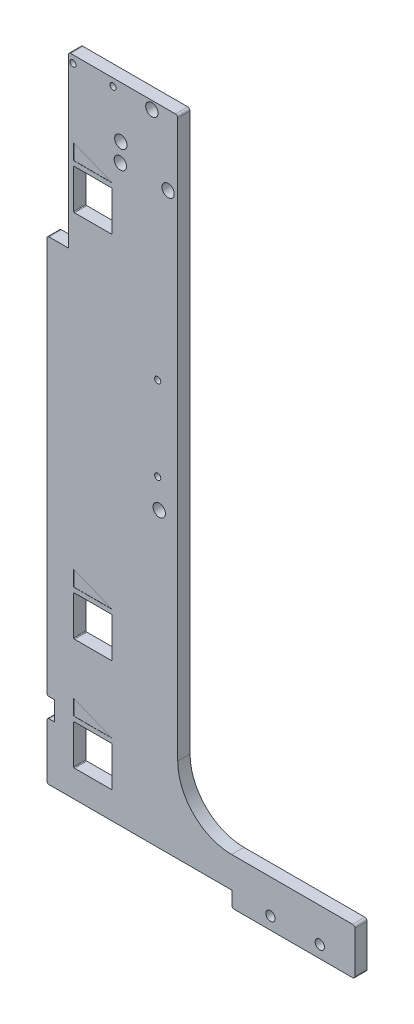
from build123d import *

# Parameters (mm, degrees)
BASE_DEPTH               = 4
REDONDEO1_R              = 35
FORATS_GUIA_LEFT_REACH   = 474.491
CROQUIS2_R               = 2
CROQUIS2_R_2             = 3
FORATS_RIGHT_REACH       = 474.491
CROQUIS4_R               = 4
TATXUELES_REACH          = 474.491
CROQUIS5_W               = 25
CROQUIS5_H               = 26
REDONDEO3_R              = 0.5
GEOMETRIA_EXTERIOR_REACH = 474.491
CROQUIS7_W               = 5
CROQUIS7_H               = 12.5
CROQUIS7_W_2             = 12.5
CROQUIS7_H_2             = 17.5
CROQUIS7_W_3             = 120.2
CROQUIS7_H_3             = 10
TRIANGLES_DEPTH          = 0.1
CROQUIS10_W              = 0.664850428
CROQUIS10_H              = 5.413782051
CUT_EXTRUDE_R_DEPTH      = 0.1
REDONDEO7_R              = 1.5
RIGHT_CUT_REACH          = 474.491
CROQUIS11_W              = 14.203186264
CROQUIS11_H              = 18.832440688
REDONDEO8_R              = 1.5


with BuildPart() as part:
    # Croquis1 → Base (new, symmetric)
    with BuildSketch(Plane.XY):
        Polygon((0, 0), (-200, 0), (-200, 428), (-115, 428), (-115, 30), (0, 30), align=None)
    extrude(amount=BASE_DEPTH, both=True)

    # Redondeo1
    redondeo1_edges = [part.edges().sort_by_distance(p)[0] for p in [
        (-115, 30, 0),
    ]]
    fillet(redondeo1_edges, radius=REDONDEO1_R)

    # Croquis2 → Forats guia Left (cut, up to next)
    with BuildSketch(Plane.XY.offset(4), mode=Mode.PRIVATE) as forats_guia_left_sk1:
        with Locations((-183, 423.2)):
            Circle(CROQUIS2_R)
    forats_guia_left_tool1 = extrude(forats_guia_left_sk1.sketch, amount=-FORATS_GUIA_LEFT_REACH, mode=Mode.PRIVATE) & part.part
    # Croquis2 → Forats guia Left (cut, up to next)
    with BuildSketch(Plane.XY.offset(4), mode=Mode.PRIVATE) as forats_guia_left_sk2:
        with Locations((-157, 423.2)):
            Circle(CROQUIS2_R)
    forats_guia_left_tool2 = extrude(forats_guia_left_sk2.sketch, amount=-FORATS_GUIA_LEFT_REACH, mode=Mode.PRIVATE) & part.part
    # Croquis2 → Forats guia Left (cut, up to next)
    with BuildSketch(Plane.XY.offset(4), mode=Mode.PRIVATE) as forats_guia_left_sk3:
        with Locations((-128, 272.65)):
            Circle(CROQUIS2_R)
    forats_guia_left_tool3 = extrude(forats_guia_left_sk3.sketch, amount=-FORATS_GUIA_LEFT_REACH, mode=Mode.PRIVATE) & part.part
    # Croquis2 → Forats guia Left (cut, up to next)
    with BuildSketch(Plane.XY.offset(4), mode=Mode.PRIVATE) as forats_guia_left_sk4:
        with Locations((-128, 218.35)):
            Circle(CROQUIS2_R)
    forats_guia_left_tool4 = extrude(forats_guia_left_sk4.sketch, amount=-FORATS_GUIA_LEFT_REACH, mode=Mode.PRIVATE) & part.part
    # Croquis2 → Forats guia Left (cut, up to next)
    with BuildSketch(Plane.XY.offset(4), mode=Mode.PRIVATE) as forats_guia_left_sk5:
        with Locations((-54.8, 8)):
            Circle(CROQUIS2_R_2)
    forats_guia_left_tool5 = extrude(forats_guia_left_sk5.sketch, amount=-FORATS_GUIA_LEFT_REACH, mode=Mode.PRIVATE) & part.part
    # Croquis2 → Forats guia Left (cut, up to next)
    with BuildSketch(Plane.XY.offset(4), mode=Mode.PRIVATE) as forats_guia_left_sk6:
        with Locations((-22.8, 8)):
            Circle(CROQUIS2_R_2)
    forats_guia_left_tool6 = extrude(forats_guia_left_sk6.sketch, amount=-FORATS_GUIA_LEFT_REACH, mode=Mode.PRIVATE) & part.part
    add(forats_guia_left_tool1.solids().sort_by_distance((-183, 423.2, 4))[0], mode=Mode.SUBTRACT)
    add(forats_guia_left_tool2.solids().sort_by_distance((-157, 423.2, 4))[0], mode=Mode.SUBTRACT)
    add(forats_guia_left_tool3.solids().sort_by_distance((-128, 272.65, 4))[0], mode=Mode.SUBTRACT)
    add(forats_guia_left_tool4.solids().sort_by_distance((-128, 218.35, 4))[0], mode=Mode.SUBTRACT)
    add(forats_guia_left_tool5.solids().sort_by_distance((-54.8, 8, 4))[0], mode=Mode.SUBTRACT)
    add(forats_guia_left_tool6.solids().sort_by_distance((-22.8, 8, 4))[0], mode=Mode.SUBTRACT)

    # Croquis4 → Forats Right (cut, up to next)
    with BuildSketch(Plane(origin=(0, 0, -4), x_dir=(-1, 0, 0), z_dir=(0, 0, -1)), mode=Mode.PRIVATE) as forats_right_sk1:
        with Locations((131.8, 422.75)):
            Circle(CROQUIS4_R)
    forats_right_tool1 = extrude(forats_right_sk1.sketch, amount=-FORATS_RIGHT_REACH, mode=Mode.PRIVATE) & part.part
    # Croquis4 → Forats Right (cut, up to next)
    with BuildSketch(Plane(origin=(0, 0, -4), x_dir=(-1, 0, 0), z_dir=(0, 0, -1)), mode=Mode.PRIVATE) as forats_right_sk2:
        with Locations((151.95, 394.65)):
            Circle(CROQUIS4_R)
    forats_right_tool2 = extrude(forats_right_sk2.sketch, amount=-FORATS_RIGHT_REACH, mode=Mode.PRIVATE) & part.part
    # Croquis4 → Forats Right (cut, up to next)
    with BuildSketch(Plane(origin=(0, 0, -4), x_dir=(-1, 0, 0), z_dir=(0, 0, -1)), mode=Mode.PRIVATE) as forats_right_sk3:
        with Locations((152.25, 382.59)):
            Circle(CROQUIS4_R)
    forats_right_tool3 = extrude(forats_right_sk3.sketch, amount=-FORATS_RIGHT_REACH, mode=Mode.PRIVATE) & part.part
    # Croquis4 → Forats Right (cut, up to next)
    with BuildSketch(Plane(origin=(0, 0, -4), x_dir=(-1, 0, 0), z_dir=(0, 0, -1)), mode=Mode.PRIVATE) as forats_right_sk4:
        with Locations((121.25, 382.59)):
            Circle(CROQUIS4_R)
    forats_right_tool4 = extrude(forats_right_sk4.sketch, amount=-FORATS_RIGHT_REACH, mode=Mode.PRIVATE) & part.part
    # Croquis4 → Forats Right (cut, up to next)
    with BuildSketch(Plane(origin=(0, 0, -4), x_dir=(-1, 0, 0), z_dir=(0, 0, -1)), mode=Mode.PRIVATE) as forats_right_sk5:
        with Locations((127, 200)):
            Circle(CROQUIS4_R)
    forats_right_tool5 = extrude(forats_right_sk5.sketch, amount=-FORATS_RIGHT_REACH, mode=Mode.PRIVATE) & part.part
    add(forats_right_tool1.solids().sort_by_distance((-131.8, 422.75, -4))[0], mode=Mode.SUBTRACT)
    add(forats_right_tool2.solids().sort_by_distance((-151.95, 394.65, -4))[0], mode=Mode.SUBTRACT)
    add(forats_right_tool3.solids().sort_by_distance((-152.25, 382.59, -4))[0], mode=Mode.SUBTRACT)
    add(forats_right_tool4.solids().sort_by_distance((-121.25, 382.59, -4))[0], mode=Mode.SUBTRACT)
    add(forats_right_tool5.solids().sort_by_distance((-127, 200, -4))[0], mode=Mode.SUBTRACT)

    # Croquis5 → Tatxueles (cut, up to next)
    with BuildSketch(Plane.XY.offset(4), mode=Mode.PRIVATE) as tatxueles_sk1:
        with Locations((-170, 40.5)):
            Rectangle(CROQUIS5_W, CROQUIS5_H)
    tatxueles_tool1 = extrude(tatxueles_sk1.sketch, amount=-TATXUELES_REACH, mode=Mode.PRIVATE) & part.part
    # Croquis5 → Tatxueles (cut, up to next)
    with BuildSketch(Plane.XY.offset(4), mode=Mode.PRIVATE) as tatxueles_sk2:
        with Locations((-170, 113)):
            Rectangle(CROQUIS5_W, CROQUIS5_H)
    tatxueles_tool2 = extrude(tatxueles_sk2.sketch, amount=-TATXUELES_REACH, mode=Mode.PRIVATE) & part.part
    # Croquis5 → Tatxueles (cut, up to next)
    with BuildSketch(Plane.XY.offset(4), mode=Mode.PRIVATE) as tatxueles_sk3:
        with Locations((-170, 352.7)):
            Rectangle(CROQUIS5_W, CROQUIS5_H)
    tatxueles_tool3 = extrude(tatxueles_sk3.sketch, amount=-TATXUELES_REACH, mode=Mode.PRIVATE) & part.part
    add(tatxueles_tool1.solids().sort_by_distance((-170, 40.5, 4))[0], mode=Mode.SUBTRACT)
    add(tatxueles_tool2.solids().sort_by_distance((-170, 113, 4))[0], mode=Mode.SUBTRACT)
    add(tatxueles_tool3.solids().sort_by_distance((-170, 352.7, 4))[0], mode=Mode.SUBTRACT)

    # Redondeo3
    redondeo3_edges = [part.edges().sort_by_distance(p)[0] for p in [
        (-182.5, 339.7, 0),
        (-182.5, 365.7, 0),
        (-157.5, 365.7, 0),
        (-157.5, 339.7, 0),
        (-182.5, 27.5, 0),
        (-182.5, 53.5, 0),
        (-157.5, 53.5, 0),
        (-157.5, 27.5, 0),
        (-182.5, 100, 0),
        (-182.5, 126, 0),
        (-157.5, 126, 0),
        (-157.5, 100, 0),
    ]]
    fillet(redondeo3_edges, radius=REDONDEO3_R)

    # Croquis7 → Geometria exterior (cut, up to next)
    with BuildSketch(Plane.XY.offset(4), mode=Mode.PRIVATE) as geometria_exterior_sk1:
        with Locations((-197.5, 53.25)):
            Rectangle(CROQUIS7_W, CROQUIS7_H)
    geometria_exterior_tool1 = extrude(geometria_exterior_sk1.sketch, amount=-GEOMETRIA_EXTERIOR_REACH, mode=Mode.PRIVATE) & part.part
    # Croquis7 → Geometria exterior (cut, up to next)
    with BuildSketch(Plane.XY.offset(4), mode=Mode.PRIVATE) as geometria_exterior_sk2:
        Polygon((-200, 428), (-200, 336.7), (-187.5, 336.7), (-186, 336.7), (-186, 428), align=None)
    geometria_exterior_tool2 = extrude(geometria_exterior_sk2.sketch, amount=-GEOMETRIA_EXTERIOR_REACH, mode=Mode.PRIVATE) & part.part
    # Croquis7 → Geometria exterior (cut, up to next)
    with BuildSketch(Plane.XY.offset(4), mode=Mode.PRIVATE) as geometria_exterior_sk3:
        with Locations((-193.75, 327.95)):
            Rectangle(CROQUIS7_W_2, CROQUIS7_H_2)
    geometria_exterior_tool3 = extrude(geometria_exterior_sk3.sketch, amount=-GEOMETRIA_EXTERIOR_REACH, mode=Mode.PRIVATE) & part.part
    # Croquis7 → Geometria exterior (cut, up to next)
    with BuildSketch(Plane.XY.offset(4), mode=Mode.PRIVATE) as geometria_exterior_sk4:
        with Locations((-139.9, 5)):
            Rectangle(CROQUIS7_W_3, CROQUIS7_H_3)
    geometria_exterior_tool4 = extrude(geometria_exterior_sk4.sketch, amount=-GEOMETRIA_EXTERIOR_REACH, mode=Mode.PRIVATE) & part.part
    add(geometria_exterior_tool1.solids().sort_by_distance((-197.5, 53.25, 4))[0], mode=Mode.SUBTRACT)
    add(geometria_exterior_tool2.solids().sort_by_distance((-193, 382.35, 4))[0], mode=Mode.SUBTRACT)
    add(geometria_exterior_tool3.solids().sort_by_distance((-193.75, 327.95, 4))[0], mode=Mode.SUBTRACT)
    add(geometria_exterior_tool4.solids().sort_by_distance((-139.9, 5, 4))[0], mode=Mode.SUBTRACT)

    # Croquis8 → Triangles (cut)
    with BuildSketch(Plane.XY.offset(4)):
        Polygon((-182.5, 66.5), (-182.5, 56.5), (-157.5, 56.5), align=None)
        Polygon((-182.5, 129), (-182.5, 139), (-157.5, 129), align=None)
        Polygon((-182.5, 368.7), (-182.5, 378.7), (-157.5, 368.7), align=None)
    triangles = extrude(amount=-TRIANGLES_DEPTH, mode=Mode.SUBTRACT)

    # Simetría1: Triangles across plane
    add(triangles.mirror(Plane.XY), mode=Mode.SUBTRACT)

    # Croquis10 → R (cut)
    # profile 1 of 8: a face of its own
    with BuildSketch(Plane(origin=(0, 0, -4), x_dir=(-1, 0, 0), z_dir=(0, 0, -1))):
        with BuildLine():
            Line((151.982138716, 278.893297564), (163.048845446, 278.893297564))
            add(Edge.make_bspline(
                [(163.048845446, 278.893297564), (163.780351393, 278.890701138), (165.187243381, 278.885707478), (167.215904786, 278.806920765), (169.079509273, 278.697282587), (170.780816077, 278.529971817), (172.319097351, 278.308137959), (173.695894812, 278.04663255), (174.911168218, 277.748591072), (175.975166721, 277.377207874), (176.935372757, 276.958293258), (177.830418276, 276.476952683), (178.680049315, 275.938546028), (179.478587006, 275.328906357), (180.232970831, 274.659000937), (180.94462398, 273.928155443), (181.603490133, 273.130172605), (182.205489566, 272.270094664), (182.754163591, 271.365312393), (183.239076352, 270.414583519), (183.633408216, 269.417246874), (183.981842689, 268.38771613), (184.232808751, 267.311273941), (184.407351977, 266.198399655), (184.535145698, 265.045175836), (184.542493226, 264.261726775), (184.54624128, 263.862080951)],
                knots=[0, 0, 0, 0, 1.749336639, 3.364467119, 4.854658419, 6.213483162, 7.451590619, 8.570285859, 9.5643256, 10.440900261, 11.26203566, 12.067320669, 12.869050712, 13.665104639, 14.467235401, 15.27997916, 16.102287765, 16.939272006, 17.78853747, 18.631303466, 19.488103222, 20.351255419, 21.228522269, 22.127379805, 23.044756219, 24, 24, 24, 24], degree=3))
            add(Edge.make_bspline(
                [(184.54624128, 263.862080951), (184.536505185, 263.444942517), (184.517414477, 262.627010076), (184.414581541, 261.425534031), (184.226635237, 260.276045791), (183.941963216, 259.181910915), (183.614769704, 258.12951162), (183.179686263, 257.138265331), (182.688651598, 256.193755807), (182.105464072, 255.309343493), (181.465444253, 254.465383824), (180.721114667, 253.694212027), (179.920696438, 252.954380536), (179.019195142, 252.292229887), (178.056349793, 251.662987846), (177.013029667, 251.092726983), (175.896043831, 250.567112254), (175.110747471, 250.273993173), (174.70916863, 250.124100181)],
                knots=[0, 0, 0, 0, 1.099860209, 2.156625411, 3.176576793, 4.16617041, 5.135385252, 6.078461593, 7.016046972, 7.938469504, 8.868247731, 9.803980173, 10.76021508, 11.73834243, 12.748633912, 13.790971185, 14.870363756, 16, 16, 16, 16], degree=3))
            Line((174.70916863, 250.124100181), (186.920707092, 225.976630897))
            Line((186.920707092, 225.976630897), (176.362814463, 225.976630897))
            Line((176.362814463, 225.976630897), (164.70249128, 249.042870213))
            Line((164.70249128, 249.042870213), (161.480001963, 249.042870213))
            Line((161.480001963, 249.042870213), (161.480001963, 225.976630897))
            Line((161.480001963, 225.976630897), (151.982138716, 225.976630897))
            Line((151.982138716, 225.976630897), (151.982138716, 278.893297564))
        make_face()
        with BuildLine():
            Line((161.480001963, 258.540733461), (165.179504501, 258.540733461))
            add(Edge.make_bspline(
                [(165.179504501, 258.540733461), (165.631799438, 258.545827511), (166.497847057, 258.555581521), (167.743337281, 258.600824664), (168.874539438, 258.709838283), (169.896311291, 258.847572916), (170.813794305, 259.006607441), (171.618804854, 259.23451357), (172.323746921, 259.478720757), (172.920266918, 259.782206943), (173.429919897, 260.127336559), (173.869972624, 260.519412383), (174.233959325, 260.973190225), (174.533538946, 261.476338361), (174.76657932, 262.033307012), (174.936680941, 262.637981925), (175.031742592, 263.297251125), (175.042679759, 263.752236641), (175.048378032, 263.989284476)],
                knots=[0, 0, 0, 0, 1.688639943, 3.233382647, 4.650958383, 5.928841754, 7.082724185, 8.122798841, 9.049171256, 9.863274652, 10.613301712, 11.341792392, 12.054588806, 12.776240173, 13.521029143, 14.301969904, 15.115324896, 16, 16, 16, 16], degree=3))
            add(Edge.make_bspline(
                [(175.048378032, 263.989284476), (175.037604924, 264.269729371), (175.016443151, 264.820611397), (174.806452621, 265.613688351), (174.472193056, 266.347735333), (174.014014743, 267.019435738), (173.436998726, 267.608294681), (172.774827321, 268.127378529), (172.013209271, 268.537831196), (171.308008269, 268.808561404), (170.666440192, 268.970542081), (170.087445244, 269.091248649), (169.416965608, 269.176796858), (168.654495109, 269.267535962), (167.80197731, 269.326375678), (166.854765479, 269.369316942), (165.815580001, 269.386886323), (165.091169025, 269.392502944), (164.713091573, 269.395434316)],
                knots=[0, 0, 0, 0, 1.020303359, 2.004196876, 2.966617323, 3.9489082, 4.950758222, 5.960522915, 7.003732012, 8.091992268, 8.70421221, 9.413913587, 10.24622431, 11.166358409, 12.212345909, 13.359657661, 14.621978493, 16, 16, 16, 16], degree=3))
            Line((164.713091573, 269.395434316), (161.480001963, 269.395434316))
            Line((161.480001963, 269.395434316), (161.480001963, 258.540733461))
        make_face(mode=Mode.SUBTRACT)
    # profile 2 of 8: a face of its own
    with BuildSketch(Plane(origin=(0, 0, -4), x_dir=(-1, 0, 0), z_dir=(0, 0, -1))):
        with BuildLine():
            Line((151.033993717, 214.181050645), (151.660259075, 214.556513052))
            add(Edge.make_bspline(
                [(151.660259075, 214.556513052), (151.718506011, 214.459010104), (151.830104891, 214.272198218), (152.016268601, 214.019768699), (152.209166597, 213.8052188), (152.410227353, 213.629796648), (152.61822361, 213.491686504), (152.83451319, 213.39389178), (153.058367223, 213.332897966), (153.210711812, 213.325489449), (153.286768156, 213.32179083)],
                knots=[0, 0, 0, 0, 1.272034388, 2.437168799, 3.508375237, 4.49857839, 5.41946034, 6.295179144, 7.148887113, 8, 8, 8, 8], degree=3))
            add(Edge.make_bspline(
                [(153.286768156, 213.32179083), (153.351722011, 213.323599887), (153.480493181, 213.327186346), (153.670066595, 213.361647377), (153.854178076, 213.414589716), (154.029033026, 213.490410688), (154.192218744, 213.582143816), (154.335319582, 213.692943225), (154.459030522, 213.816993027), (154.560226481, 213.955386313), (154.637865889, 214.104224278), (154.6975391, 214.256996708), (154.730654506, 214.416103511), (154.735642968, 214.523228991), (154.738160384, 214.577289628)],
                knots=[0, 0, 0, 0, 1.095163259, 2.171163733, 3.241058638, 4.321873601, 5.38011039, 6.391990106, 7.366004449, 8.327778327, 9.272591725, 10.192022065, 11.087607919, 12, 12, 12, 12], degree=3))
            add(Edge.make_bspline(
                [(154.738160384, 214.577289628), (154.73503976, 214.638971093), (154.728695986, 214.764360498), (154.675077687, 214.94935643), (154.590730114, 215.13243237), (154.512915852, 215.245676716), (154.472517021, 215.304469783)],
                knots=[0, 0, 0, 0, 0.938893495, 1.908633276, 2.914225137, 4, 4, 4, 4], degree=3))
            add(Edge.make_bspline(
                [(154.472517021, 215.304469783), (154.439347554, 215.346902226), (154.369712408, 215.435983833), (154.249999007, 215.568582915), (154.109524065, 215.705358568), (153.953094873, 215.851533572), (153.775013169, 216.000309408), (153.580856597, 216.158780597), (153.365668095, 216.320920601), (153.214750827, 216.429659198), (153.136880002, 216.485766524)],
                knots=[0, 0, 0, 0, 0.722233717, 1.516239348, 2.393582979, 3.351407094, 4.387010283, 5.505090956, 6.712668013, 8, 8, 8, 8], degree=3))
            add(Edge.make_bspline(
                [(153.136880002, 216.485766524), (153.058935877, 216.541283701), (152.909912645, 216.647428316), (152.701508645, 216.804959718), (152.515147865, 216.948985908), (152.351658614, 217.080862734), (152.2111128, 217.20060808), (152.092402914, 217.307072052), (151.998552968, 217.403133922), (151.946365322, 217.465451429), (151.922934356, 217.493430453)],
                knots=[0, 0, 0, 0, 1.452282411, 2.77665338, 3.964542531, 5.026858415, 5.96415736, 6.766646006, 7.446254459, 8, 8, 8, 8], degree=3))
            add(Edge.make_bspline(
                [(151.922934356, 217.493430453), (151.890184135, 217.537035981), (151.82577643, 217.622792104), (151.740758386, 217.75682972), (151.668497158, 217.894038965), (151.611850221, 218.034788545), (151.564148558, 218.177102478), (151.532064271, 218.322837614), (151.511974148, 218.471340023), (151.509916776, 218.571275266), (151.50888688, 218.621301714)],
                knots=[0, 0, 0, 0, 1.068054152, 2.10047183, 3.106115577, 4.101338837, 5.06977816, 6.043150881, 7.020423561, 8, 8, 8, 8], degree=3))
            add(Edge.make_bspline(
                [(151.50888688, 218.621301714), (151.511649572, 218.699681403), (151.517115906, 218.854765472), (151.563345001, 219.081314063), (151.636312626, 219.297608646), (151.738536805, 219.501507852), (151.870314869, 219.687702512), (152.022812181, 219.858334392), (152.204446494, 220.001777891), (152.403736213, 220.127110082), (152.621872201, 220.225208957), (152.850452946, 220.299209698), (153.089841749, 220.341139294), (153.25198505, 220.347156479), (153.334257473, 220.350209633)],
                knots=[0, 0, 0, 0, 1.005424448, 1.989358655, 2.955360095, 3.929531133, 4.905563448, 5.876582895, 6.856512386, 7.866279853, 8.892233794, 9.918561126, 10.94386622, 12, 12, 12, 12], degree=3))
            add(Edge.make_bspline(
                [(153.334257473, 220.350209633), (153.421557485, 220.347198566), (153.595169346, 220.341210513), (153.850543519, 220.289145739), (154.096417035, 220.202995983), (154.294205279, 220.105229991), (154.449002958, 220.007585161), (154.567055242, 219.918643199), (154.686683846, 219.816249219), (154.808853729, 219.700130482), (154.931494791, 219.569221525), (155.056427765, 219.424418901), (155.183944801, 219.266607524), (155.265978038, 219.153948997), (155.308032179, 219.096194876)],
                knots=[0, 0, 0, 0, 1.286793592, 2.559021753, 3.825965368, 5.121522368, 5.803751409, 6.523245864, 7.299691795, 8.125521123, 9.008227632, 9.944561021, 10.946284179, 12, 12, 12, 12], degree=3))
            Line((155.308032179, 219.096194876), (154.70699552, 218.640594249))
            add(Edge.make_bspline(
                [(154.70699552, 218.640594249), (154.670703296, 218.687348643), (154.600812959, 218.777386676), (154.494705545, 218.903479294), (154.394695907, 219.018660842), (154.296164227, 219.118705363), (154.204314374, 219.209091546), (154.115166635, 219.286476364), (154.030003925, 219.351618041), (153.92265313, 219.42113691), (153.78778396, 219.490048176), (153.618483358, 219.548360391), (153.441559076, 219.583401939), (153.321058023, 219.588035084), (153.260055416, 219.590380573)],
                knots=[0, 0, 0, 0, 1.181633172, 2.275549214, 3.290209073, 4.226197932, 5.078386478, 5.862611352, 6.581680152, 7.217281963, 8.414376989, 9.595101626, 10.782541182, 12, 12, 12, 12], degree=3))
            add(Edge.make_bspline(
                [(153.260055416, 219.590380573), (153.18352411, 219.587815808), (153.035940696, 219.582869901), (152.826411363, 219.528852599), (152.637829222, 219.443800994), (152.475792959, 219.324600957), (152.340883025, 219.183374856), (152.243293137, 219.020859613), (152.184555289, 218.841403527), (152.177387663, 218.716220355), (152.173737307, 218.652466578)],
                knots=[0, 0, 0, 0, 1.14458467, 2.207223713, 3.21896685, 4.227309161, 5.202851033, 6.127160689, 7.046193047, 8, 8, 8, 8], degree=3))
            add(Edge.make_bspline(
                [(152.173737307, 218.652466578), (152.174569425, 218.612775948), (152.176235022, 218.533329787), (152.19946501, 218.41595761), (152.22930859, 218.298881942), (152.276600494, 218.182629142), (152.34188972, 218.065166082), (152.427625675, 217.94447007), (152.535603853, 217.819477287), (152.618316862, 217.738181679), (152.66198684, 217.695260047)],
                knots=[0, 0, 0, 0, 0.858281714, 1.717966888, 2.583508476, 3.4729293, 4.427298488, 5.488583878, 6.674047936, 8, 8, 8, 8], degree=3))
            add(Edge.make_bspline(
                [(152.66198684, 217.695260047), (152.678203411, 217.680788342), (152.716730273, 217.646406885), (152.787164316, 217.590119891), (152.880176572, 217.520687356), (152.993338231, 217.434777536), (153.128735814, 217.335121775), (153.286384208, 217.222994296), (153.464526119, 217.094755074), (153.590937507, 217.00509828), (153.657778439, 216.957691604)],
                knots=[0, 0, 0, 0, 0.420754252, 0.999615792, 1.744751191, 2.668019286, 3.750313428, 4.999500688, 6.413464383, 8, 8, 8, 8], degree=3))
            add(Edge.make_bspline(
                [(153.657778439, 216.957691604), (153.738181956, 216.89918406), (153.893872222, 216.785892309), (154.115397433, 216.61567912), (154.316255993, 216.44920801), (154.497153107, 216.287542075), (154.659875897, 216.131907611), (154.802619072, 215.980432213), (154.926837096, 215.834201084), (155.060566442, 215.646722465), (155.197213826, 215.41646917), (155.314565017, 215.134363565), (155.388560186, 214.851161354), (155.39823656, 214.660816216), (155.403010811, 214.56690134)],
                knots=[0, 0, 0, 0, 1.163667725, 2.253281268, 3.268753668, 4.215851969, 5.092017293, 5.902905408, 6.650798638, 7.335211899, 8.59617414, 9.77448103, 10.901945474, 12, 12, 12, 12], degree=3))
            add(Edge.make_bspline(
                [(155.403010811, 214.56690134), (155.401619869, 214.5004838), (155.398864995, 214.368938505), (155.367197728, 214.175781926), (155.320801103, 213.988179918), (155.250872291, 213.808451397), (155.165521606, 213.633308316), (155.057219715, 213.467344927), (154.931685116, 213.30688805), (154.787680313, 213.156216326), (154.630103153, 213.017900212), (154.463556, 212.894860365), (154.287766255, 212.79226908), (154.103687552, 212.708553131), (153.911277606, 212.643077186), (153.71060113, 212.595636613), (153.501327331, 212.566520358), (153.359086312, 212.563498263), (153.286768156, 212.56196177)],
                knots=[0, 0, 0, 0, 0.983748083, 1.948392443, 2.894712957, 3.844097841, 4.80183111, 5.778335162, 6.776009319, 7.81870978, 8.863265674, 9.881300176, 10.883814829, 11.87499822, 12.874611388, 13.892143829, 14.928324115, 16, 16, 16, 16], degree=3))
            add(Edge.make_bspline(
                [(153.286768156, 212.56196177), (153.230813347, 212.563043771), (153.119608422, 212.565194146), (152.955123352, 212.584204523), (152.793961221, 212.611101226), (152.638144324, 212.653803007), (152.485665136, 212.705612609), (152.337186823, 212.769405413), (152.192637426, 212.845853489), (152.051206875, 212.933261291), (151.913254872, 213.034983517), (151.780075332, 213.153460751), (151.647298556, 213.285425404), (151.518843567, 213.434461096), (151.392112078, 213.598160038), (151.269602778, 213.77805381), (151.148779809, 213.973162542), (151.072970402, 214.110460306), (151.033993717, 214.181050645)],
                knots=[0, 0, 0, 0, 0.915332311, 1.819136955, 2.706846663, 3.586547465, 4.459518054, 5.340707479, 6.227863349, 7.133153174, 8.059268498, 9.028702269, 10.047606654, 11.120612155, 12.245963614, 13.433783089, 14.680604001, 16, 16, 16, 16], degree=3))
        make_face()
    # profile 3 of 8: a face of its own
    with BuildSketch(Plane(origin=(0, 0, -4), x_dir=(-1, 0, 0), z_dir=(0, 0, -1))):
        with BuildLine():
            add(Edge.make_bspline(
                [(156.967190165, 220.445188266), (157.008446783, 220.443274476), (157.089235166, 220.439526909), (157.206060916, 220.407435116), (157.312438258, 220.353037449), (157.406794459, 220.280055458), (157.487760953, 220.194225802), (157.54444679, 220.094190086), (157.580879695, 219.986115967), (157.585279304, 219.910730695), (157.587519358, 219.872348388)],
                knots=[0, 0, 0, 0, 1.055194115, 2.066272739, 3.074728998, 4.095836921, 5.109056067, 6.073838105, 7.019297344, 8, 8, 8, 8], degree=3))
            add(Edge.make_bspline(
                [(157.587519358, 219.872348388), (157.585228787, 219.834962439), (157.580700598, 219.761054842), (157.544474931, 219.654854326), (157.487277861, 219.556208593), (157.406846378, 219.47054559), (157.312424501, 219.397603944), (157.206064571, 219.34319558), (157.089234205, 219.311106623), (157.008446458, 219.307358665), (156.967190165, 219.305444676)],
                knots=[0, 0, 0, 0, 0.96129708, 1.900370562, 2.859976407, 3.87933698, 4.906634145, 5.921202961, 6.938410037, 8, 8, 8, 8], degree=3))
            add(Edge.make_bspline(
                [(156.967190165, 219.305444676), (156.926405649, 219.307285584), (156.847023918, 219.31086867), (156.731947435, 219.343825208), (156.626477132, 219.397622562), (156.531936908, 219.470067988), (156.453133, 219.556734687), (156.395774878, 219.654794125), (156.359632875, 219.761070169), (156.355093411, 219.834967588), (156.352797136, 219.872348388)],
                knots=[0, 0, 0, 0, 1.054934014, 2.053291228, 3.073705704, 4.106921865, 5.123545215, 6.088680038, 7.033164197, 8, 8, 8, 8], degree=3))
            add(Edge.make_bspline(
                [(156.352797136, 219.872348388), (156.355043103, 219.910725353), (156.359454323, 219.986100134), (156.395801969, 220.094251287), (156.452655229, 220.193695466), (156.531989088, 220.280532773), (156.626463246, 220.353018943), (156.731951023, 220.406805521), (156.84702297, 220.439764856), (156.926405327, 220.443347556), (156.967190165, 220.445188266)],
                knots=[0, 0, 0, 0, 0.98631895, 1.937192651, 2.907499808, 3.917963147, 4.944918757, 5.95915025, 6.951458133, 8, 8, 8, 8], degree=3))
        make_face()
    # profile 4 of 8: a face of its own
    with BuildSketch(Plane(origin=(0, 0, -4), x_dir=(-1, 0, 0), z_dir=(0, 0, -1))):
        with Locations((156.970158247, 215.458810061)):
            Rectangle(CROQUIS10_W, CROQUIS10_H)
    # profile 5 of 8: a face of its own
    with BuildSketch(Plane(origin=(0, 0, -4), x_dir=(-1, 0, 0), z_dir=(0, 0, -1))):
        with BuildLine():
            Line((163.666151837, 218.165701086), (164.331002264, 218.165701086))
            Line((164.331002264, 218.165701086), (164.331002264, 213.869402008))
            add(Edge.make_bspline(
                [(164.331002264, 213.869402008), (164.330415857, 213.777882432), (164.329283951, 213.601227607), (164.321132729, 213.345791915), (164.303943962, 213.109855367), (164.284452253, 212.89234192), (164.25641337, 212.694259787), (164.222173393, 212.515017904), (164.183574539, 212.354444263), (164.149665078, 212.25554335), (164.133624794, 212.20875998)],
                knots=[0, 0, 0, 0, 1.307562039, 2.523909702, 3.650326591, 4.686913197, 5.643429486, 6.506965704, 7.293745905, 8, 8, 8, 8], degree=3))
            add(Edge.make_bspline(
                [(164.133624794, 212.20875998), (164.109940905, 212.147948313), (164.063281261, 212.028143208), (163.975893336, 211.858313896), (163.878031574, 211.69840737), (163.766257285, 211.549314765), (163.641075916, 211.411784534), (163.505436758, 211.282828735), (163.356698186, 211.165175581), (163.194945245, 211.060855035), (163.023906655, 210.966902437), (162.843680739, 210.88552387), (162.655283778, 210.814643384), (162.456945991, 210.761551466), (162.251776994, 210.715546308), (162.037364099, 210.685606723), (161.814960012, 210.66522945), (161.663733957, 210.663345123), (161.58701021, 210.66238912)],
                knots=[0, 0, 0, 0, 0.981931301, 1.934503488, 2.87077864, 3.801706999, 4.735015492, 5.667491629, 6.616593066, 7.585388521, 8.561939025, 9.551802639, 10.560317337, 11.588439944, 12.640189604, 13.723962949, 14.845264515, 16, 16, 16, 16], degree=3))
            add(Edge.make_bspline(
                [(161.58701021, 210.66238912), (161.475070855, 210.664202015), (161.25642322, 210.667743086), (160.937642653, 210.708998856), (160.634885829, 210.767322279), (160.352153229, 210.855598768), (160.091231524, 210.963627063), (159.853902654, 211.087653047), (159.642297143, 211.229870417), (159.451535368, 211.391796689), (159.279362336, 211.584336482), (159.117379572, 211.811240702), (158.961463912, 212.075965617), (158.870090295, 212.270260193), (158.82224158, 212.372004505)],
                knots=[0, 0, 0, 0, 1.157897085, 2.2616841, 3.32207898, 4.345638746, 5.321241055, 6.241986252, 7.112515963, 7.955008012, 8.825025602, 9.77857164, 10.836726669, 12, 12, 12, 12], degree=3))
            Line((158.82224158, 212.372004505), (159.487092008, 212.372004505))
            add(Edge.make_bspline(
                [(159.487092008, 212.372004505), (159.540563684, 212.287113735), (159.645094227, 212.121162732), (159.840565178, 211.906293218), (160.054785236, 211.722665263), (160.294983899, 211.574687458), (160.562160604, 211.4631184), (160.85647609, 211.383584022), (161.18032529, 211.335966924), (161.405788843, 211.330228018), (161.523196442, 211.327239548)],
                knots=[0, 0, 0, 0, 0.997731894, 1.950442991, 2.880492273, 3.800895997, 4.748200782, 5.754801363, 6.83083817, 8, 8, 8, 8], degree=3))
            add(Edge.make_bspline(
                [(161.523196442, 211.327239548), (161.639119693, 211.330266696), (161.862608118, 211.336102735), (162.183984092, 211.383605273), (162.477343378, 211.463135708), (162.740995802, 211.574490126), (162.971830513, 211.710910153), (163.170822561, 211.86331031), (163.331995459, 212.035143433), (163.440396238, 212.19343159), (163.507779512, 212.334452664), (163.55068908, 212.455848992), (163.585558982, 212.593120917), (163.614726305, 212.745808225), (163.638794738, 212.914129066), (163.654040839, 213.098468303), (163.665059807, 213.29840699), (163.66577941, 213.437034133), (163.666151837, 213.508780012)],
                knots=[0, 0, 0, 0, 1.570740765, 3.028230971, 4.391408896, 5.680370741, 6.894727393, 8.017376726, 9.065722033, 10.075533815, 10.603371122, 11.180248986, 11.817768598, 12.521299649, 13.286540596, 14.121245857, 15.027658897, 16, 16, 16, 16], degree=3))
            Line((163.666151837, 213.508780012), (163.666151837, 213.789263786))
            add(Edge.make_bspline(
                [(163.666151837, 213.789263786), (163.598670138, 213.708953639), (163.464893724, 213.549745974), (163.233865215, 213.341123843), (162.981522743, 213.1614482), (162.708295912, 213.014088757), (162.420877466, 212.896229742), (162.122380412, 212.813800474), (161.815480561, 212.760545353), (161.607513511, 212.754814867), (161.502419866, 212.751919035)],
                knots=[0, 0, 0, 0, 1.012485704, 2.007162095, 2.997754123, 3.998611389, 4.999708251, 5.992315798, 6.98544096, 8, 8, 8, 8], degree=3))
            add(Edge.make_bspline(
                [(161.502419866, 212.751919035), (161.440536429, 212.753009174), (161.317501882, 212.755176552), (161.134717667, 212.774139298), (160.954630739, 212.801653302), (160.7776611, 212.842042348), (160.603553385, 212.893883169), (160.432595316, 212.9586886), (160.263402684, 213.031957267), (160.09905093, 213.118259701), (159.941176954, 213.214276583), (159.790971545, 213.318287235), (159.649221471, 213.429747279), (159.517275901, 213.549755802), (159.395307914, 213.678139113), (159.28167706, 213.813528633), (159.178262342, 213.957814902), (159.082941668, 214.108366962), (159.000269853, 214.266187584), (158.927701266, 214.427854553), (158.864604692, 214.59302219), (158.814301258, 214.762243473), (158.775881402, 214.935411717), (158.747284754, 215.112243234), (158.731064882, 215.293282554), (158.728535627, 215.415247743), (158.727262948, 215.476618554)],
                knots=[0, 0, 0, 0, 1.028754217, 2.045334182, 3.052854819, 4.056607503, 5.061168794, 6.071104265, 7.095078842, 8.125279047, 9.155117945, 10.165957491, 11.161587969, 12.151493252, 13.128948131, 14.104219989, 15.088194871, 16.07871515, 17.064853787, 18.047899887, 19.02414258, 20.002704429, 20.980574569, 21.971845993, 22.979467364, 24, 24, 24, 24], degree=3))
            add(Edge.make_bspline(
                [(158.727262948, 215.476618554), (158.72836185, 215.538008441), (158.730555398, 215.660550442), (158.749501637, 215.842328474), (158.776527638, 216.021672445), (158.819300749, 216.196733779), (158.870783422, 216.36950617), (158.934544984, 216.538713469), (159.011208024, 216.704407214), (159.098011995, 216.866710105), (159.195556657, 217.023444223), (159.302517075, 217.172302291), (159.419022376, 217.312188921), (159.543465264, 217.444515347), (159.67736521, 217.568004841), (159.820652943, 217.682357684), (159.97191604, 217.789490706), (160.131623302, 217.887093036), (160.297310442, 217.973415458), (160.464768022, 218.052182122), (160.636214287, 218.114696008), (160.808452828, 218.169778234), (160.984516981, 218.208799397), (161.162247964, 218.238903143), (161.342254246, 218.257243469), (161.462804541, 218.259532824), (161.523196442, 218.260679719)],
                knots=[0, 0, 0, 0, 1.008818848, 2.013730394, 3.001654427, 3.987803273, 4.973046549, 5.963777569, 6.957074694, 7.972068341, 8.987420212, 9.989399531, 10.982630087, 11.977756091, 12.973280677, 13.973972381, 14.989194003, 16.018387222, 17.047741039, 18.059210846, 19.057554164, 20.045176975, 21.029480261, 22.018708529, 23.007435371, 24, 24, 24, 24], degree=3))
            add(Edge.make_bspline(
                [(161.523196442, 218.260679719), (161.622787596, 218.257808093), (161.819449524, 218.252137516), (162.108863479, 218.207642759), (162.388141221, 218.136704764), (162.658858687, 218.035071679), (162.923221148, 217.896324098), (163.180357319, 217.713564858), (163.431011153, 217.485154639), (163.585692561, 217.309994409), (163.666151837, 217.218882844)],
                knots=[0, 0, 0, 0, 0.96728863, 1.910097829, 2.838038873, 3.762875196, 4.71315279, 5.730631239, 6.819562287, 8, 8, 8, 8], degree=3))
            Line((163.666151837, 217.218882844), (163.666151837, 218.165701086))
        make_face()
        with BuildLine():
            add(Edge.make_bspline(
                [(161.576621922, 217.595829291), (161.479401932, 217.592525036), (161.286926967, 217.585983311), (161.004799976, 217.530135668), (160.7324338, 217.44262018), (160.475035644, 217.317434977), (160.233932261, 217.164835507), (160.019990558, 216.979965231), (159.832866819, 216.768835781), (159.674576266, 216.533356092), (159.548568207, 216.279308942), (159.459364636, 216.011527888), (159.40168542, 215.73433982), (159.395319223, 215.54516781), (159.392113375, 215.449905814)],
                knots=[0, 0, 0, 0, 1.026226791, 2.031711442, 3.026614839, 4.04107745, 5.047145931, 6.032893242, 7.017642609, 8.019221815, 9.021877557, 10.003543541, 10.994637589, 12, 12, 12, 12], degree=3))
            add(Edge.make_bspline(
                [(159.392113375, 215.449905814), (159.393649561, 215.378080387), (159.396670788, 215.236820776), (159.425719027, 215.029518899), (159.472668737, 214.832075568), (159.539210824, 214.644478842), (159.621660694, 214.465652693), (159.725361213, 214.29682898), (159.847389103, 214.137857352), (159.986789252, 213.989913609), (160.14040926, 213.855164559), (160.307031565, 213.736762373), (160.486430177, 213.639923347), (160.674192925, 213.556228574), (160.874875692, 213.495101214), (161.085587924, 213.448452465), (161.307820349, 213.421763928), (161.459313863, 213.418456006), (161.536552812, 213.416769462)],
                knots=[0, 0, 0, 0, 1.039728707, 2.044842319, 3.024901384, 3.974314358, 4.923051295, 5.871625912, 6.837440708, 7.820715446, 8.810779094, 9.792721783, 10.773906224, 11.758876063, 12.764959493, 13.806266761, 14.881525401, 16, 16, 16, 16], degree=3))
            add(Edge.make_bspline(
                [(161.536552812, 213.416769462), (161.614792767, 213.418394235), (161.767790169, 213.42157146), (161.991248651, 213.448883865), (162.202984618, 213.492957048), (162.402803926, 213.555532119), (162.591461031, 213.635376491), (162.766836632, 213.736418998), (162.932691114, 213.851490379), (163.083728847, 213.985712476), (163.220304998, 214.133635715), (163.339326788, 214.29459741), (163.440745705, 214.466175508), (163.524730106, 214.64835067), (163.588846488, 214.842538651), (163.631854837, 215.048254004), (163.661925781, 215.264511168), (163.664721738, 215.412696072), (163.666151837, 215.488490883)],
                knots=[0, 0, 0, 0, 1.121943988, 2.193949579, 3.223793937, 4.220241907, 5.192961521, 6.155822191, 7.11847367, 8.083710714, 9.04790392, 10.001595906, 10.949595423, 11.902125208, 12.873731292, 13.87582262, 14.913508608, 16, 16, 16, 16], degree=3))
            add(Edge.make_bspline(
                [(163.666151837, 215.488490883), (163.663316418, 215.587165341), (163.657777005, 215.779940556), (163.605501354, 216.060836549), (163.521215243, 216.324930241), (163.403006284, 216.57138639), (163.254877699, 216.797593604), (163.076462069, 216.999362408), (162.870836304, 217.176952554), (162.638591192, 217.324903731), (162.3887241, 217.444422233), (162.127270901, 217.534087984), (161.854619758, 217.584875951), (161.669821191, 217.592157165), (161.576621922, 217.595829291)],
                knots=[0, 0, 0, 0, 1.070913519, 2.092188694, 3.091357305, 4.074328408, 5.051968682, 6.018948707, 6.99050112, 7.9935919, 9.000589572, 9.992915277, 10.987769056, 12, 12, 12, 12], degree=3))
        make_face(mode=Mode.SUBTRACT)
    # profile 6 of 8: a face of its own
    with BuildSketch(Plane(origin=(0, 0, -4), x_dir=(-1, 0, 0), z_dir=(0, 0, -1))):
        with BuildLine():
            Line((165.850660384, 218.165701086), (166.515510811, 218.165701086))
            Line((166.515510811, 218.165701086), (166.515510811, 217.224819008))
            add(Edge.make_bspline(
                [(166.515510811, 217.224819008), (166.575378505, 217.307131098), (166.690090746, 217.464848955), (166.878189711, 217.672685056), (167.066099149, 217.849062984), (167.201424807, 217.941652062), (167.266435624, 217.986132109)],
                knots=[0, 0, 0, 0, 1.134379233, 2.173579362, 3.122582517, 4, 4, 4, 4], degree=3))
            add(Edge.make_bspline(
                [(167.266435624, 217.986132109), (167.355049159, 218.028476799), (167.530728047, 218.112426367), (167.80889874, 218.1975874), (168.09353679, 218.249922198), (168.28574751, 218.257079438), (168.382434556, 218.260679719)],
                knots=[0, 0, 0, 0, 1.014936303, 2.012140481, 3.000054389, 4, 4, 4, 4], degree=3))
            add(Edge.make_bspline(
                [(168.382434556, 218.260679719), (168.447824732, 218.258467186), (168.577228374, 218.254088704), (168.768964698, 218.225598296), (168.954932093, 218.176351564), (169.134031789, 218.107756061), (169.302773893, 218.024683907), (169.457479362, 217.927212025), (169.596383936, 217.817786549), (169.719417411, 217.691466141), (169.830053515, 217.544703674), (169.931820407, 217.373541014), (170.025853773, 217.174134798), (170.077968877, 217.02942562), (170.105406311, 216.953239481)],
                knots=[0, 0, 0, 0, 1.009824226, 1.998387844, 2.986035974, 3.974953746, 4.955485308, 5.885931332, 6.793869504, 7.679848016, 8.601185859, 9.625726857, 10.749998409, 12, 12, 12, 12], degree=3))
            add(Edge.make_bspline(
                [(170.105406311, 216.953239481), (170.134428459, 217.005572835), (170.191539972, 217.108557526), (170.287436904, 217.254307515), (170.387910407, 217.390635224), (170.49381675, 217.517648823), (170.604782126, 217.634721085), (170.721328756, 217.742239077), (170.84279321, 217.840664529), (171.011686785, 217.95564855), (171.231423471, 218.077782718), (171.50846998, 218.183676257), (171.79665451, 218.249115396), (171.992271971, 218.256799473), (172.091053346, 218.260679719)],
                knots=[0, 0, 0, 0, 0.86119277, 1.694706429, 2.50939023, 3.298075842, 4.073795165, 4.829715201, 5.57930267, 6.321991688, 7.768977793, 9.186738141, 10.579381044, 12, 12, 12, 12], degree=3))
            add(Edge.make_bspline(
                [(172.091053346, 218.260679719), (172.181819109, 218.257256601), (172.35945652, 218.250557228), (172.618065066, 218.197950709), (172.859241887, 218.107616356), (173.082501698, 217.984355159), (173.283923303, 217.829459221), (173.459006157, 217.645163515), (173.60668676, 217.432771629), (173.703161547, 217.232975253), (173.768598857, 217.056582132), (173.808945136, 216.906285482), (173.844589157, 216.740864695), (173.874182793, 216.560121975), (173.895812062, 216.363418854), (173.911836743, 216.151077233), (173.922682698, 215.92293208), (173.923449085, 215.765525105), (173.923844145, 215.684384313)],
                knots=[0, 0, 0, 0, 1.209669288, 2.367440248, 3.500751976, 4.631527125, 5.755587489, 6.87532382, 8.007944318, 9.190864318, 9.82315674, 10.514484317, 11.263564316, 12.079023757, 12.955305781, 13.901327259, 14.918167583, 16, 16, 16, 16], degree=3))
            Line((173.923844145, 215.684384313), (173.923844145, 212.751919035))
            Line((173.923844145, 212.751919035), (173.258993717, 212.751919035))
            Line((173.258993717, 212.751919035), (173.258993717, 215.687352395))
            add(Edge.make_bspline(
                [(173.258993717, 215.687352395), (173.258828865, 215.756610943), (173.258512044, 215.88971534), (173.252810524, 216.080749695), (173.242067776, 216.254884384), (173.229506124, 216.411881971), (173.212056727, 216.552108573), (173.189522838, 216.675282526), (173.165651749, 216.78237276), (173.125993901, 216.901088227), (173.062604197, 217.032046839), (172.966047198, 217.173278408), (172.84440214, 217.296216102), (172.703939808, 217.402934872), (172.544028934, 217.489704746), (172.36778527, 217.5516723), (172.176303027, 217.590032393), (172.043751458, 217.593855126), (171.975298138, 217.595829291)],
                knots=[0, 0, 0, 0, 1.253487763, 2.409012846, 3.458416907, 4.410876679, 5.259312806, 6.014470957, 6.676830364, 7.243083969, 8.276244668, 9.299465089, 10.325150304, 11.392391894, 12.482080715, 13.603491619, 14.762376348, 16, 16, 16, 16], degree=3))
            add(Edge.make_bspline(
                [(171.975298138, 217.595829291), (171.891330068, 217.592831758), (171.725377239, 217.586907493), (171.483134293, 217.526426129), (171.250362308, 217.435239598), (171.034006943, 217.303090897), (170.834981453, 217.144746527), (170.663744013, 216.956469883), (170.522282554, 216.743469871), (170.426494971, 216.546309351), (170.36598095, 216.369209028), (170.326024812, 216.214486257), (170.294944967, 216.038630272), (170.265797347, 215.84282275), (170.246773322, 215.625715868), (170.229483601, 215.388313919), (170.221396108, 215.129902872), (170.220264837, 214.950776381), (170.219677478, 214.857773402)],
                knots=[0, 0, 0, 0, 1.090531906, 2.155305635, 3.229839962, 4.33261226, 5.44038871, 6.529323825, 7.629011124, 8.757537029, 9.370236727, 10.061839251, 10.834451254, 11.692844982, 12.636905849, 13.66920014, 14.789842145, 16, 16, 16, 16], degree=3))
            Line((170.219677478, 214.857773402), (170.219677478, 212.751919035))
            Line((170.219677478, 212.751919035), (169.554827051, 212.751919035))
            Line((169.554827051, 212.751919035), (169.554827051, 215.504815336))
            add(Edge.make_bspline(
                [(169.554827051, 215.504815336), (169.554658922, 215.58248286), (169.554335459, 215.731907371), (169.548670587, 215.946185317), (169.537903904, 216.14109027), (169.525456744, 216.316395702), (169.507549366, 216.471783015), (169.487208703, 216.608085252), (169.463187477, 216.724960709), (169.423415555, 216.853153207), (169.362636597, 216.99437916), (169.264871442, 217.144960989), (169.142935397, 217.276761795), (168.999910376, 217.389281146), (168.839031682, 217.482290615), (168.661266817, 217.549303756), (168.468216419, 217.588301836), (168.335125274, 217.59327282), (168.266679348, 217.595829291)],
                knots=[0, 0, 0, 0, 1.320475261, 2.540461679, 3.643808994, 4.639130445, 5.527981419, 6.302341397, 6.981980563, 7.553956391, 8.582137848, 9.585246428, 10.591171744, 11.620968678, 12.668337649, 13.738356861, 14.836885341, 16, 16, 16, 16], degree=3))
            add(Edge.make_bspline(
                [(168.266679348, 217.595829291), (168.1862117, 217.592589818), (168.025842536, 217.586133661), (167.790253367, 217.528022115), (167.562742003, 217.436996824), (167.346937891, 217.310716873), (167.148660943, 217.154297157), (166.975076778, 216.970327294), (166.829148432, 216.76109684), (166.732349424, 216.56601528), (166.669910987, 216.393351848), (166.628434195, 216.246559009), (166.59279032, 216.08357515), (166.566302308, 215.903897431), (166.540732095, 215.708696116), (166.528391274, 215.496998779), (166.516386467, 215.268987027), (166.515809856, 215.111565139), (166.515510811, 215.029922173)],
                knots=[0, 0, 0, 0, 1.098833095, 2.189935336, 3.297829714, 4.440610912, 5.596351641, 6.740013378, 7.886572111, 9.072425424, 9.705826452, 10.395263256, 11.156850408, 11.985370555, 12.878090359, 13.847760091, 14.883794034, 16, 16, 16, 16], degree=3))
            Line((166.515510811, 215.029922173), (166.515510811, 212.751919035))
            Line((166.515510811, 212.751919035), (165.850660384, 212.751919035))
            Line((165.850660384, 212.751919035), (165.850660384, 218.165701086))
        make_face()
    # profile 7 of 8: a face of its own
    with BuildSketch(Plane(origin=(0, 0, -4), x_dir=(-1, 0, 0), z_dir=(0, 0, -1))):
        with BuildLine():
            Line((180.952262948, 218.165701086), (180.952262948, 212.751919035))
            Line((180.952262948, 212.751919035), (180.287412521, 212.751919035))
            Line((180.287412521, 212.751919035), (180.287412521, 213.688348989))
            add(Edge.make_bspline(
                [(180.287412521, 213.688348989), (180.212442747, 213.603598516), (180.066138291, 213.4382069), (179.821787925, 213.222132968), (179.562775282, 213.043532188), (179.290357485, 212.899281533), (179.004780537, 212.790925014), (178.706677486, 212.713907643), (178.395926729, 212.664390692), (178.183725912, 212.659446113), (178.076191233, 212.656940402)],
                knots=[0, 0, 0, 0, 1.074387032, 2.096679803, 3.090159297, 4.057316773, 5.018401886, 5.985159533, 6.978961417, 8, 8, 8, 8], degree=3))
            add(Edge.make_bspline(
                [(178.076191233, 212.656940402), (177.980585731, 212.659536224), (177.792047447, 212.664655298), (177.514702567, 212.704368841), (177.247807306, 212.768145323), (176.991109461, 212.856835539), (176.746270086, 212.974481612), (176.511192881, 213.115327254), (176.287095683, 213.283053677), (176.077394259, 213.474798337), (175.884286525, 213.683067727), (175.714823498, 213.905202468), (175.573529479, 214.140242011), (175.455376975, 214.38521052), (175.364368046, 214.641993766), (175.300923853, 214.909703772), (175.261256574, 215.188024004), (175.256139616, 215.377549328), (175.253544999, 215.473650472)],
                knots=[0, 0, 0, 0, 1.033919861, 2.038935746, 3.024066025, 3.998881131, 4.97069526, 5.957263378, 6.95902576, 7.993208707, 9.027059324, 10.027763471, 11.009749337, 11.988697705, 12.965288445, 13.950418724, 14.960734635, 16, 16, 16, 16], degree=3))
            add(Edge.make_bspline(
                [(175.253544999, 215.473650472), (175.256197122, 215.567765311), (175.261440226, 215.753825271), (175.300499541, 216.027465182), (175.366181843, 216.291028834), (175.45835812, 216.543667697), (175.576556925, 216.78568747), (175.720338042, 217.017259323), (175.889711856, 217.239021214), (176.084979451, 217.445758644), (176.296508048, 217.636725611), (176.522798195, 217.802691424), (176.758220807, 217.94602542), (177.006427513, 218.059591945), (177.263744551, 218.15147455), (177.532462678, 218.215044332), (177.811463853, 218.252503662), (178.000885395, 218.25792818), (178.096967809, 218.260679719)],
                knots=[0, 0, 0, 0, 1.020392517, 2.01726096, 2.990465484, 3.961182959, 4.928053699, 5.906110375, 6.912531644, 7.948652711, 8.985773172, 9.998621852, 10.987621588, 11.969261332, 12.953316658, 13.946091881, 14.958173133, 16, 16, 16, 16], degree=3))
            add(Edge.make_bspline(
                [(178.096967809, 218.260679719), (178.207457511, 218.257636478), (178.424122601, 218.251668826), (178.741046887, 218.202006054), (179.040861032, 218.118104631), (179.325879411, 218.003979261), (179.59507853, 217.852322784), (179.845909846, 217.661018533), (180.080998453, 217.431273021), (180.21727007, 217.25480558), (180.287412521, 217.163973322)],
                knots=[0, 0, 0, 0, 1.038897134, 2.037228247, 3.008116434, 3.962042015, 4.918381754, 5.904844433, 6.921570401, 8, 8, 8, 8], degree=3))
            Line((180.287412521, 217.163973322), (180.287412521, 218.165701086))
            Line((180.287412521, 218.165701086), (180.952262948, 218.165701086))
        make_face()
        with BuildLine():
            add(Edge.make_bspline(
                [(178.105872056, 217.595829291), (178.008686707, 217.592371425), (177.816858287, 217.585546146), (177.535248483, 217.532262248), (177.265768423, 217.443606523), (177.009765899, 217.322359833), (176.771284841, 217.169899007), (176.558149904, 216.985492079), (176.368617853, 216.774170399), (176.20921536, 216.536887598), (176.079272142, 216.282510639), (175.987901924, 216.016605578), (175.927642017, 215.743968376), (175.921485649, 215.559050691), (175.918395427, 215.466230266)],
                knots=[0, 0, 0, 0, 1.031046209, 2.035121221, 3.029706178, 4.034933723, 5.034054252, 6.02443088, 7.017295772, 8.038157696, 9.050218397, 10.03989886, 11.016116709, 12, 12, 12, 12], degree=3))
            add(Edge.make_bspline(
                [(175.918395427, 215.466230266), (175.922342784, 215.373964539), (175.930222027, 215.189794736), (175.98684433, 214.916785849), (176.081840062, 214.650818126), (176.211469095, 214.394149023), (176.373789117, 214.155846011), (176.561936765, 213.940496085), (176.777731527, 213.75530979), (177.016761417, 213.600290259), (177.272048288, 213.475062923), (177.540513443, 213.387928986), (177.81711021, 213.331672684), (178.005180984, 213.325101541), (178.099935891, 213.32179083)],
                knots=[0, 0, 0, 0, 0.979072187, 1.954306742, 2.945804271, 3.96968567, 4.997920485, 5.998718438, 6.996577872, 8.005894225, 9.015743152, 10.005417472, 10.995077863, 12, 12, 12, 12], degree=3))
            add(Edge.make_bspline(
                [(178.099935891, 213.32179083), (178.196130989, 213.32530442), (178.387453497, 213.332292603), (178.669898762, 213.385804614), (178.943996433, 213.474215237), (179.206012733, 213.596768389), (179.450098544, 213.748654792), (179.669169052, 213.926469802), (179.854411185, 214.133274875), (180.011452209, 214.360555034), (180.134590174, 214.609712093), (180.224286166, 214.875002797), (180.277316933, 215.15643638), (180.284000794, 215.348765026), (180.287412521, 215.446937731)],
                knots=[0, 0, 0, 0, 1.01762866, 2.023962475, 3.030623092, 4.058876274, 5.077231937, 6.066672613, 7.034107872, 8.005628644, 8.981990164, 9.965428785, 10.961468474, 12, 12, 12, 12], degree=3))
            add(Edge.make_bspline(
                [(180.287412521, 215.446937731), (180.285381248, 215.521736139), (180.281383061, 215.668963077), (180.250838355, 215.885132989), (180.202250427, 216.092002709), (180.133784368, 216.289789734), (180.043844482, 216.477400517), (179.935370044, 216.656182142), (179.806453509, 216.825204773), (179.659170136, 216.98214094), (179.49795379, 217.125283619), (179.327362013, 217.253054595), (179.145373665, 217.358017497), (178.95504927, 217.444888188), (178.756058612, 217.514016722), (178.546782467, 217.560134007), (178.329445278, 217.59180002), (178.181181127, 217.59447206), (178.105872056, 217.595829291)],
                knots=[0, 0, 0, 0, 1.050140795, 2.067009409, 3.05949893, 4.030605086, 5.00011959, 5.97591094, 6.962425594, 7.979863591, 8.993523472, 9.986985069, 10.967611495, 11.937549037, 12.921786183, 13.919465291, 14.943216303, 16, 16, 16, 16], degree=3))
        make_face(mode=Mode.SUBTRACT)
    # profile 8 of 8: a face of its own
    with BuildSketch(Plane(origin=(0, 0, -4), x_dir=(-1, 0, 0), z_dir=(0, 0, -1))):
        Polygon((182.139495854, 220.160252368), (182.906745119, 220.160252368), (184.84638688, 217.129840376), (186.78602864, 220.160252368), (187.553277905, 220.160252368), (185.230753533, 216.530287758), (187.648256538, 212.751919035), (186.881007272, 212.751919035), (184.84638688, 215.930735141), (182.811766487, 212.751919035), (182.044517221, 212.751919035), (184.463504267, 216.530287758), align=None)
    extrude(amount=-CUT_EXTRUDE_R_DEPTH, mode=Mode.SUBTRACT)

    # Redondeo7
    redondeo7_edges = [part.edges().sort_by_distance(p)[0] for p in [
        (-79.8, 0, 0),
        (0, 0, 0),
        (0, 30, 0),
        (-115, 428, 0),
        (-186, 428, 0),
        (-187.5, 336.7, 0),
        (-200, 319.2, 0),
        (-200, 47, 0),
        (-200, 10, 0),
        (-200, 59.5, 0),
    ]]
    fillet(redondeo7_edges, radius=REDONDEO7_R - 0.0001)  # a hair under: the kernel refuses the full size

    # Croquis11 → right cut (cut, up to next)
    with BuildSketch(Plane(origin=(0, 0, -4), x_dir=(-1, 0, 0), z_dir=(0, 0, -1)), mode=Mode.PRIVATE) as right_cut_sk1:
        with Locations((193.101593132, 327.283779656)):
            Rectangle(CROQUIS11_W, CROQUIS11_H)
    right_cut_tool1 = extrude(right_cut_sk1.sketch, amount=-RIGHT_CUT_REACH, mode=Mode.PRIVATE) & part.part
    add(right_cut_tool1.solids().sort_by_distance((-193.101593, 327.28378, -4))[0], mode=Mode.SUBTRACT)

    # Redondeo8
    redondeo8_edges = [part.edges().sort_by_distance(p)[0] for p in [
        (-199.990622522, 317.867559312, 0),
    ]]
    fillet(redondeo8_edges, radius=REDONDEO8_R)


solid = part.part
